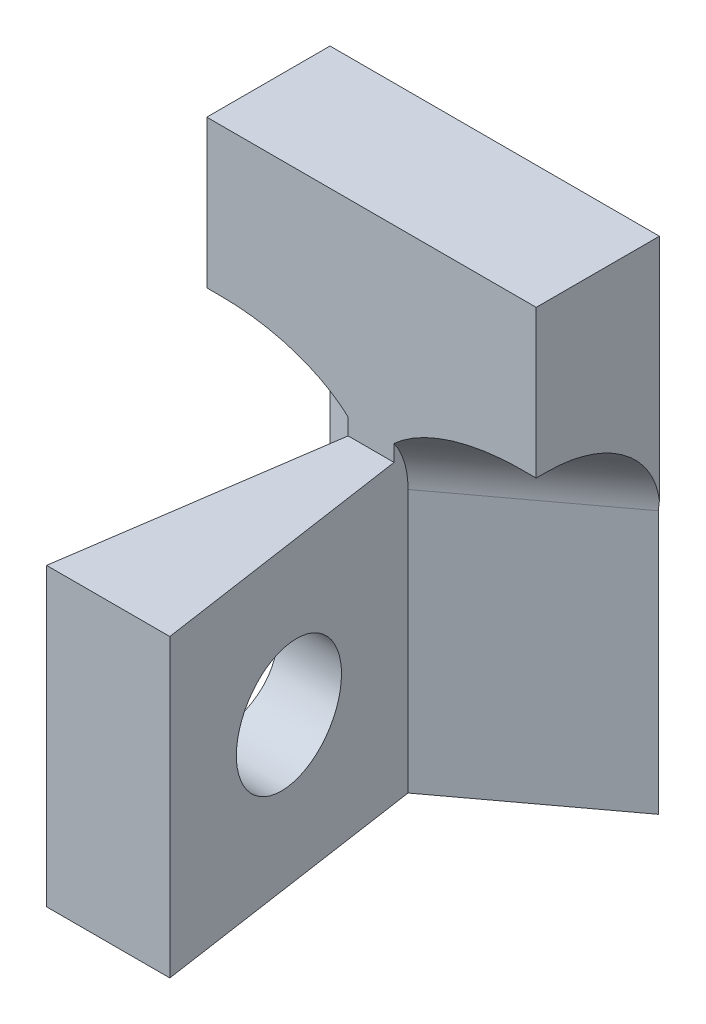
from build123d import *

# Parameters (mm, degrees)
BOSS_EXTRUDE1_DEPTH = 36
SKETCH2_R           = 7.5
CUT_EXTRUDE1_DEPTH  = 72.449282712
BOSS_EXTRUDE5_DEPTH = 7
SKETCH9_W           = 40.098560475
SKETCH9_H           = 15
BOSS_EXTRUDE6_DEPTH = 18
FILLET4_R           = 11


with BuildPart() as part:
    # Sketch1 → Boss-Extrude1 (new body)
    with BuildSketch(Plane(origin=(0, 0, 0), x_dir=(1, 0, 0), z_dir=(0, 1, 0))):
        Polygon((27.5, 0), (12.5, 0), (17.5, 34), (0, 47), (40, 47), (22.5, 34), align=None)
    extrude(amount=BOSS_EXTRUDE1_DEPTH)

    # Sketch2 → Cut-Extrude1 (cut, through all)
    with BuildSketch(Plane(origin=(0, 0, 0), x_dir=(0, 0, -1), z_dir=(1, 0, 0))):
        with Locations((17, 18)):
            Circle(SKETCH2_R)
    extrude(amount=CUT_EXTRUDE1_DEPTH, mode=Mode.SUBTRACT)

    # Sketch7 → Boss-Extrude5 (add)
    with BuildSketch(Plane(origin=(0, 36, 0), x_dir=(1, 0, 0), z_dir=(0, 1, 0))):
        Polygon((0, 47), (40, 47), (22.5, 34), (22.794117647, 32), (17.205882353, 32), (17.5, 34), align=None)
    extrude(amount=BOSS_EXTRUDE5_DEPTH)

    # Sketch9 → Boss-Extrude6 (add)
    with BuildSketch(Plane(origin=(0, 43, 0), x_dir=(1, 0, 0), z_dir=(0, 1, 0))):
        with Locations((20.049280237, 39.5)):
            Rectangle(SKETCH9_W, SKETCH9_H)
    extrude(amount=BOSS_EXTRUDE6_DEPTH)

    # Fillet4
    fillet4_edges = [part.edges().sort_by_distance(p)[0] for p in [
        (31.25, 43, -40.5),
        (8.75, 43, -40.5),
    ]]
    fillet(fillet4_edges, radius=FILLET4_R)


solid = part.part
